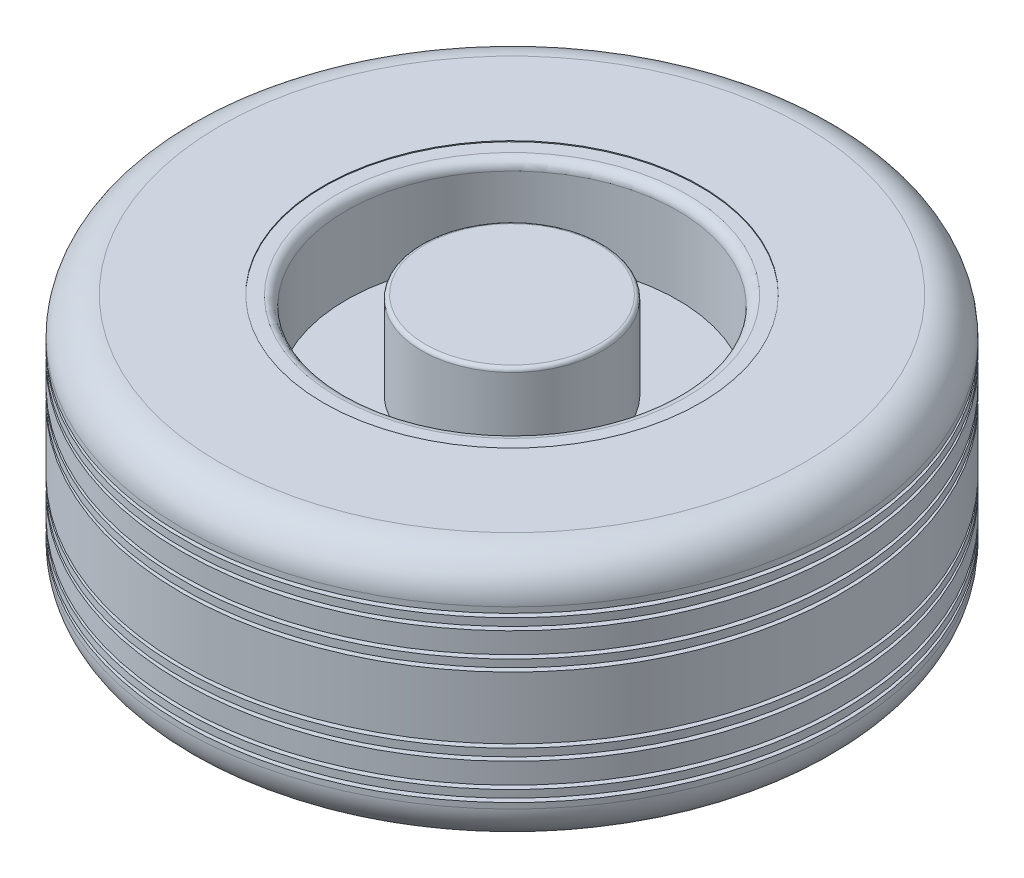
from build123d import *

# Parameters (mm, degrees)
BOSS_EXTRUDE1_DEPTH              = 84.455
BOSS_EXTRUDE1_DEPTH_BACK         = 84.455
SKETCH1_R                        = 222.25
SKETCH1_R_2                      = 127
CUT_REVOLVE_THIN1_START          = -55.245
CUT_REVOLVE_THIN1_OUTLINE_R      = 222.25
CUT_REVOLVE_THIN1_OUTLINE_R_2    = 208.28
CUT_REVOLVE_THIN1_DEPTH          = 2.54
CUT_REVOLVE_THIN1_START_2        = -47.625
CUT_REVOLVE_THIN1_2_OUTLINE_R    = 222.25
CUT_REVOLVE_THIN1_2_OUTLINE_R_2  = 208.28
CUT_REVOLVE_THIN1_2_DEPTH        = 2.54
CUT_REVOLVE_THIN1_START_3        = -31.115
CUT_REVOLVE_THIN1_3_OUTLINE_R    = 222.25
CUT_REVOLVE_THIN1_3_OUTLINE_R_2  = 208.28
CUT_REVOLVE_THIN1_3_DEPTH        = 2.54
CUT_REVOLVE_THIN1_START_4        = -23.495
CUT_REVOLVE_THIN1_4_OUTLINE_R    = 222.25
CUT_REVOLVE_THIN1_4_OUTLINE_R_2  = 208.28
CUT_REVOLVE_THIN1_4_DEPTH        = 2.54
CUT_REVOLVE_THIN1_START_5        = 20.955
CUT_REVOLVE_THIN1_5_OUTLINE_R    = 222.25
CUT_REVOLVE_THIN1_5_OUTLINE_R_2  = 208.28
CUT_REVOLVE_THIN1_5_DEPTH        = 2.54
CUT_REVOLVE_THIN1_START_6        = 28.575
CUT_REVOLVE_THIN1_6_OUTLINE_R    = 222.25
CUT_REVOLVE_THIN1_6_OUTLINE_R_2  = 208.28
CUT_REVOLVE_THIN1_6_DEPTH        = 2.54
CUT_REVOLVE_THIN1_START_7        = 45.085
CUT_REVOLVE_THIN1_7_OUTLINE_R    = 222.25
CUT_REVOLVE_THIN1_7_OUTLINE_R_2  = 208.28
CUT_REVOLVE_THIN1_7_DEPTH        = 2.54
CUT_REVOLVE_THIN1_START_8        = 52.705
CUT_REVOLVE_THIN1_8_OUTLINE_R    = 222.25
CUT_REVOLVE_THIN1_8_OUTLINE_R_2  = 208.28
CUT_REVOLVE_THIN1_8_DEPTH        = 2.54
CUT_REVOLVE_THIN1_START_9        = -52.705
CUT_REVOLVE_THIN1_9_OUTLINE_R    = 210.82
CUT_REVOLVE_THIN1_9_OUTLINE_R_2  = 208.28
CUT_REVOLVE_THIN1_9_DEPTH        = 5.08
CUT_REVOLVE_THIN1_START_10       = -28.575
CUT_REVOLVE_THIN1_10_OUTLINE_R   = 210.82
CUT_REVOLVE_THIN1_10_OUTLINE_R_2 = 208.28
CUT_REVOLVE_THIN1_10_DEPTH       = 5.08
CUT_REVOLVE_THIN1_START_11       = 23.495
CUT_REVOLVE_THIN1_11_OUTLINE_R   = 210.82
CUT_REVOLVE_THIN1_11_OUTLINE_R_2 = 208.28
CUT_REVOLVE_THIN1_11_DEPTH       = 5.08
CUT_REVOLVE_THIN1_START_12       = 47.625
CUT_REVOLVE_THIN1_12_OUTLINE_R   = 210.82
CUT_REVOLVE_THIN1_12_OUTLINE_R_2 = 208.28
CUT_REVOLVE_THIN1_12_DEPTH       = 5.08
FILLET1_R                        = 25.4
BOSS_EXTRUDE3_DEPTH              = 84.455
BOSS_EXTRUDE3_DEPTH_BACK         = 84.455
SKETCH4_R                        = 60.96
BOSS_EXTRUDE4_DEPTH              = 25.4
BOSS_EXTRUDE4_DEPTH_BACK         = 25.4
SKETCH4_5_R                      = 111.76
SKETCH4_5_R_2                    = 60.96
BOSS_EXTRUDE5_DEPTH              = 83.82
BOSS_EXTRUDE5_DEPTH_BACK         = 83.82
SKETCH4_6_R                      = 127
SKETCH4_6_R_2                    = 111.76
FILLET3_R                        = 6.35
FILLET4_R                        = 2.54
SKETCH6_R                        = 6.35
CUT_EXTRUDE1_DEPTH               = 6.35
FILLET5_R                        = 2.54


# Read off the part's stored shape, not the designer's step: Cut-Revolve-Thin1
with BuildPart() as part:
    # Sketch1 → Boss-Extrude1 (new, two sides: drawn at the far end of the back side and taken through both)
    with BuildSketch(Plane(origin=(0, 0, 0), x_dir=(1, 0, 0), z_dir=(0, 1, 0)).offset(-BOSS_EXTRUDE1_DEPTH_BACK)):
        with Locations(Location((0, 0, 0), (0, 0, 270))):
            Circle(SKETCH1_R)
        with Locations(Location((0, 0, 0), (0, 0, 270))):
            Circle(SKETCH1_R_2, mode=Mode.SUBTRACT)
    extrude(amount=BOSS_EXTRUDE1_DEPTH + BOSS_EXTRUDE1_DEPTH_BACK)

    # Cut-Revolve-Thin1 outline → Cut-Revolve-Thin1 (cut)
    with BuildSketch(Plane(origin=(0, 0, 0), x_dir=(1, 0, 0), z_dir=(0, 1, 0)).offset(CUT_REVOLVE_THIN1_START)):
        Circle(CUT_REVOLVE_THIN1_OUTLINE_R)
        Circle(CUT_REVOLVE_THIN1_OUTLINE_R_2, mode=Mode.SUBTRACT)
    extrude(amount=CUT_REVOLVE_THIN1_DEPTH, mode=Mode.SUBTRACT)

    # Cut-Revolve-Thin1 2 outline → Cut-Revolve-Thin1 2 (cut)
    with BuildSketch(Plane(origin=(0, 0, 0), x_dir=(1, 0, 0), z_dir=(0, 1, 0)).offset(CUT_REVOLVE_THIN1_START_2)):
        Circle(CUT_REVOLVE_THIN1_2_OUTLINE_R)
        Circle(CUT_REVOLVE_THIN1_2_OUTLINE_R_2, mode=Mode.SUBTRACT)
    extrude(amount=CUT_REVOLVE_THIN1_2_DEPTH, mode=Mode.SUBTRACT)

    # Cut-Revolve-Thin1 3 outline → Cut-Revolve-Thin1 3 (cut)
    with BuildSketch(Plane(origin=(0, 0, 0), x_dir=(1, 0, 0), z_dir=(0, 1, 0)).offset(CUT_REVOLVE_THIN1_START_3)):
        Circle(CUT_REVOLVE_THIN1_3_OUTLINE_R)
        Circle(CUT_REVOLVE_THIN1_3_OUTLINE_R_2, mode=Mode.SUBTRACT)
    extrude(amount=CUT_REVOLVE_THIN1_3_DEPTH, mode=Mode.SUBTRACT)

    # Cut-Revolve-Thin1 4 outline → Cut-Revolve-Thin1 4 (cut)
    with BuildSketch(Plane(origin=(0, 0, 0), x_dir=(1, 0, 0), z_dir=(0, 1, 0)).offset(CUT_REVOLVE_THIN1_START_4)):
        Circle(CUT_REVOLVE_THIN1_4_OUTLINE_R)
        Circle(CUT_REVOLVE_THIN1_4_OUTLINE_R_2, mode=Mode.SUBTRACT)
    extrude(amount=CUT_REVOLVE_THIN1_4_DEPTH, mode=Mode.SUBTRACT)

    # Cut-Revolve-Thin1 5 outline → Cut-Revolve-Thin1 5 (cut)
    with BuildSketch(Plane(origin=(0, 0, 0), x_dir=(1, 0, 0), z_dir=(0, 1, 0)).offset(CUT_REVOLVE_THIN1_START_5)):
        Circle(CUT_REVOLVE_THIN1_5_OUTLINE_R)
        Circle(CUT_REVOLVE_THIN1_5_OUTLINE_R_2, mode=Mode.SUBTRACT)
    extrude(amount=CUT_REVOLVE_THIN1_5_DEPTH, mode=Mode.SUBTRACT)

    # Cut-Revolve-Thin1 6 outline → Cut-Revolve-Thin1 6 (cut)
    with BuildSketch(Plane(origin=(0, 0, 0), x_dir=(1, 0, 0), z_dir=(0, 1, 0)).offset(CUT_REVOLVE_THIN1_START_6)):
        Circle(CUT_REVOLVE_THIN1_6_OUTLINE_R)
        Circle(CUT_REVOLVE_THIN1_6_OUTLINE_R_2, mode=Mode.SUBTRACT)
    extrude(amount=CUT_REVOLVE_THIN1_6_DEPTH, mode=Mode.SUBTRACT)

    # Cut-Revolve-Thin1 7 outline → Cut-Revolve-Thin1 7 (cut)
    with BuildSketch(Plane(origin=(0, 0, 0), x_dir=(1, 0, 0), z_dir=(0, 1, 0)).offset(CUT_REVOLVE_THIN1_START_7)):
        Circle(CUT_REVOLVE_THIN1_7_OUTLINE_R)
        Circle(CUT_REVOLVE_THIN1_7_OUTLINE_R_2, mode=Mode.SUBTRACT)
    extrude(amount=CUT_REVOLVE_THIN1_7_DEPTH, mode=Mode.SUBTRACT)

    # Cut-Revolve-Thin1 8 outline → Cut-Revolve-Thin1 8 (cut)
    with BuildSketch(Plane(origin=(0, 0, 0), x_dir=(1, 0, 0), z_dir=(0, 1, 0)).offset(CUT_REVOLVE_THIN1_START_8)):
        Circle(CUT_REVOLVE_THIN1_8_OUTLINE_R)
        Circle(CUT_REVOLVE_THIN1_8_OUTLINE_R_2, mode=Mode.SUBTRACT)
    extrude(amount=CUT_REVOLVE_THIN1_8_DEPTH, mode=Mode.SUBTRACT)

    # Cut-Revolve-Thin1 9 outline → Cut-Revolve-Thin1 9 (cut)
    with BuildSketch(Plane(origin=(0, 0, 0), x_dir=(1, 0, 0), z_dir=(0, 1, 0)).offset(CUT_REVOLVE_THIN1_START_9)):
        Circle(CUT_REVOLVE_THIN1_9_OUTLINE_R)
        Circle(CUT_REVOLVE_THIN1_9_OUTLINE_R_2, mode=Mode.SUBTRACT)
    extrude(amount=CUT_REVOLVE_THIN1_9_DEPTH, mode=Mode.SUBTRACT)

    # Cut-Revolve-Thin1 10 outline → Cut-Revolve-Thin1 10 (cut)
    with BuildSketch(Plane(origin=(0, 0, 0), x_dir=(1, 0, 0), z_dir=(0, 1, 0)).offset(CUT_REVOLVE_THIN1_START_10)):
        Circle(CUT_REVOLVE_THIN1_10_OUTLINE_R)
        Circle(CUT_REVOLVE_THIN1_10_OUTLINE_R_2, mode=Mode.SUBTRACT)
    extrude(amount=CUT_REVOLVE_THIN1_10_DEPTH, mode=Mode.SUBTRACT)

    # Cut-Revolve-Thin1 11 outline → Cut-Revolve-Thin1 11 (cut)
    with BuildSketch(Plane(origin=(0, 0, 0), x_dir=(1, 0, 0), z_dir=(0, 1, 0)).offset(CUT_REVOLVE_THIN1_START_11)):
        Circle(CUT_REVOLVE_THIN1_11_OUTLINE_R)
        Circle(CUT_REVOLVE_THIN1_11_OUTLINE_R_2, mode=Mode.SUBTRACT)
    extrude(amount=CUT_REVOLVE_THIN1_11_DEPTH, mode=Mode.SUBTRACT)

    # Cut-Revolve-Thin1 12 outline → Cut-Revolve-Thin1 12 (cut)
    with BuildSketch(Plane(origin=(0, 0, 0), x_dir=(1, 0, 0), z_dir=(0, 1, 0)).offset(CUT_REVOLVE_THIN1_START_12)):
        Circle(CUT_REVOLVE_THIN1_12_OUTLINE_R)
        Circle(CUT_REVOLVE_THIN1_12_OUTLINE_R_2, mode=Mode.SUBTRACT)
    extrude(amount=CUT_REVOLVE_THIN1_12_DEPTH, mode=Mode.SUBTRACT)

    # Fillet1
    fillet1_edges = [part.edges().sort_by_distance(p)[0] for p in [
        (0, -84.455, -222.25),
        (0, 84.455, -222.25),
    ]]
    fillet(fillet1_edges, radius=FILLET1_R)



with BuildPart() as body_2:
    # Sketch4 → Boss-Extrude3 (new, two sides: drawn at the far end of the back side and taken through both)
    with BuildSketch(Plane(origin=(0, 0, 0), x_dir=(1, 0, 0), z_dir=(0, 1, 0)).offset(-BOSS_EXTRUDE3_DEPTH_BACK)):
        with Locations(Location((0, 0, 0), (0, 0, 270))):
            Circle(SKETCH4_R)
    extrude(amount=BOSS_EXTRUDE3_DEPTH + BOSS_EXTRUDE3_DEPTH_BACK)

    # Sketch4<5> → Boss-Extrude4 (add, two sides: drawn at the far end of the back side and taken through both)
    with BuildSketch(Plane(origin=(0, 0, 0), x_dir=(1, 0, 0), z_dir=(0, 1, 0)).offset(-BOSS_EXTRUDE4_DEPTH_BACK)):
        with Locations(Location((0, 0, 0), (0, 0, 270))):
            Circle(SKETCH4_5_R)
        with Locations(Location((0, 0, 0), (0, 0, 270))):
            Circle(SKETCH4_5_R_2, mode=Mode.SUBTRACT)
    extrude(amount=BOSS_EXTRUDE4_DEPTH + BOSS_EXTRUDE4_DEPTH_BACK)


with BuildPart() as part_1:
    add(part.part)

    add(body_2.part)  # Boss-Extrude5 merges body 2
    # Sketch4<6> → Boss-Extrude5 (add, two sides: drawn at the far end of the back side and taken through both)
    with BuildSketch(Plane(origin=(0, 0, 0), x_dir=(1, 0, 0), z_dir=(0, 1, 0)).offset(-BOSS_EXTRUDE5_DEPTH_BACK)):
        with Locations(Location((0, 0, 0), (0, 0, 270))):
            Circle(SKETCH4_6_R)
        with Locations(Location((0, 0, 0), (0, 0, 270))):
            Circle(SKETCH4_6_R_2, mode=Mode.SUBTRACT)
    extrude(amount=BOSS_EXTRUDE5_DEPTH + BOSS_EXTRUDE5_DEPTH_BACK)

    # Fillet3
    fillet3_edges = [part_1.edges().sort_by_distance(p)[0] for p in [
        (0, 83.82, -111.76),
        (0, -83.82, -111.76),
    ]]
    fillet(fillet3_edges, radius=FILLET3_R)

    # Fillet4
    fillet4_edges = [part_1.edges().sort_by_distance(p)[0] for p in [
        (0, 84.455, -60.96),
        (0, -84.455, -60.96),
    ]]
    fillet(fillet4_edges, radius=FILLET4_R)

    # Sketch6 → Cut-Extrude1 (cut)
    with BuildSketch(Plane.XZ.offset(84.455)):
        with Locations(Location((0, 0, 0), (0, 0, 270))):
            Circle(SKETCH6_R)
    extrude(amount=-CUT_EXTRUDE1_DEPTH, mode=Mode.SUBTRACT)

    # Fillet5
    fillet5_edges = [part_1.edges().sort_by_distance(p)[0] for p in [
        (0, -84.455, 6.35),
    ]]
    fillet(fillet5_edges, radius=FILLET5_R)


solid = part_1.part
